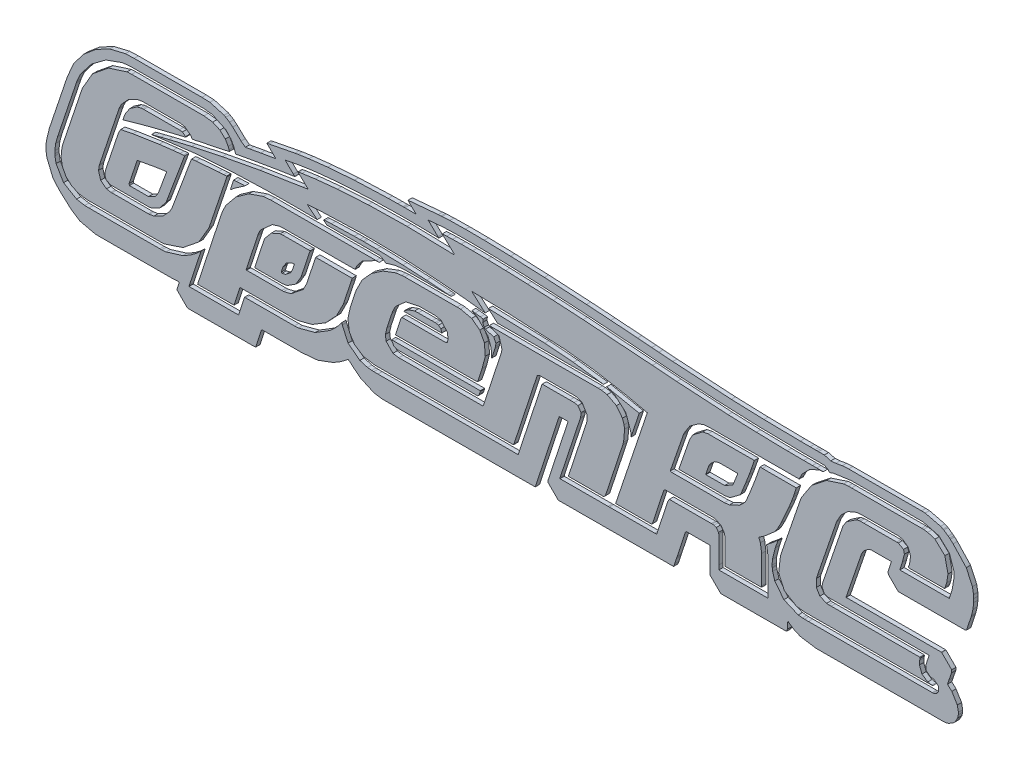
from build123d import *

# Parameters (mm, degrees)
BOSS_EXTRU_1_DEPTH    = 0.4
BOSS_EXTRU_1_2_DEPTH  = 0.4
BOSS_EXTRU_1_3_DEPTH  = 0.4
BOSS_EXTRU_1_4_DEPTH  = 0.4
BOSS_EXTRU_1_5_DEPTH  = 0.4
BOSS_EXTRU_1_6_DEPTH  = 0.4
BOSS_EXTRU_1_7_DEPTH  = 0.4
BOSS_EXTRU_1_8_DEPTH  = 0.4
BOSS_EXTRU_1_9_DEPTH  = 0.4
BOSS_EXTRU_1_10_DEPTH = 0.4
BOSS_EXTRU_1_11_DEPTH = 0.4
BOSS_EXTRU_1_12_DEPTH = 0.4
BOSS_EXTRU_1_13_DEPTH = 0.4
BOSS_EXTRU_1_14_DEPTH = 0.4
BOSS_EXTRU_1_15_DEPTH = 0.4
BOSS_EXTRU_1_16_DEPTH = 0.4
BOSS_EXTRU_1_17_DEPTH = 0.4


with BuildPart() as part:
    # Esquisse1 → Boss.-Extru.1 (new body)
    with BuildSketch(Plane.XY):
        Polygon((41.031215108, 10.587676012), (41.09815131, 11.16395312), (41.103061708, 11.488916264), (41.086468808, 11.774396873), (41.084350421, 11.802488739), (41.082807826, 11.819720388), (40.981651009, 12.399308119), (40.403476246, 13.653867984), (39.167737927, 14.970133199), (38.904284488, 15.204880924), (38.839631369, 15.261560175), (38.706337169, 15.37006367), (38.295692851, 15.647195355), (38.218579791, 15.689572147), (37.993453525, 15.803173377), (36.551980502, 16.156097871), (36.208718045, 16.166296553), (29.3755207, 16.150260667), (28.780270447, 16.114970361), (28.17662174, 16.009644537), (27.70561712, 15.973958416), (27.0973175, 16.142830444), (26.555064665, 16.143262767), (26.419501941, 16.142944634), (26.232421895, 16.142589385), (25.76365815, 16.14244763), (24.8476182, 16.145351533), (21.44234506, 16.196267525), (18.37899234, 16.301689963), (12.892457594, 16.631391996), (11.583902856, 16.730437868), (10.923617419, 16.782060961), (9.587761629, 16.885390249), (7.085132042, 17.06778692), (4.801086827, 17.219940643), (0.855829737, 17.443629287), (-2.31384919, 17.576676263), (-4.7737895, 17.639301654), (-6.542043384, 17.651885022), (-8.007942263, 17.62826436), (-8.723581381, 17.595310392), (-8.835391452, 17.587085669), (-9.092794744, 17.56438985), (-11.926656431, 17.314431765), (-11.739282789, 17.112394924), (-11.164248727, 16.566426486), (-11.281363276, 16.552493368), (-12.201931197, 16.556226735), (-12.314403446, 16.556061468), (-12.409643806, 16.555807615), (-12.875333008, 16.553154167), (-13.775654043, 16.541297274), (-16.955775974, 16.423217214), (-19.443543595, 16.235766471), (-21.214297217, 16.037176112), (-22.243377146, 15.885677209), (-22.529479006, 15.834920742), (-24.929463374, 15.370649707), (-25.164333041, 15.324929434), (-24.312653855, 14.48780417), (-25.726142312, 14.246562242), (-26.754672886, 14.064405145), (-27.177491119, 13.988801078), (-27.570882861, 14.286235062), (-28.362651446, 15.037108713), (-28.667090388, 15.28409617), (-29.008444991, 15.503861561), (-29.176399799, 15.593458388), (-30.499731017, 15.977969565), (-31.242631861, 16.008004308), (-37.597175259, 15.993091709), (-38.411998824, 15.966806036), (-39.880659512, 15.612541868), (-41.203689566, 14.919197708), (-42.337004709, 13.956918053), (-43.255744619, 12.758703541), (-43.866473628, 11.360696357), (-45.550431758, 6.329775335), (-45.83216704, 5.156871095), (-45.860946302, 4.630854859), (-45.856572118, 4.472363446), (-45.845678478, 4.313527362), (-45.833837898, 4.197759555), (-45.778327092, 3.845446049), (-45.228763523, 2.526650985), (-45.12986141, 2.389312071), (-45.099203279, 2.348555805), (-45.097771211, 2.346243974), (-44.933350293, 2.135854401), (-44.531423648, 1.707481896), (-43.509775767, 0.789182288), (-42.694161381, 0.251781386), (-41.236361869, -0.090477779), (-40.906207473, -0.097244019), (-34.231541885, -0.081580169), (-34.100567931, -0.081249833), (-33.803519413, -0.070758328), (-33.507675156, -0.04293795), (-33.371265878, -0.0860475), (-33.598385312, -0.777453621), (-33.330740628, -1.050294878), (-32.613577391, -1.764099973), (-32.367745857, -1.781776447), (-26.429671645, -1.767841202), (-26.19202718, -1.735983615), (-25.679259839, -0.147137073), (-25.620784755, -0.047161707), (-21.889677345, -0.038405687), (-20.384313266, 0.096387901), (-18.974853906, 0.617258792), (-18.335542918, 0.986859199), (-17.886929754, 1.305734166), (-17.554352811, 1.581719532), (-17.358268699, 1.457685552), (-17.045512508, 1.175193832), (-16.401655795, 0.665853385), (-15.117351667, 0.081090492), (-14.372723659, -0.026097409), (-14.005694536, -0.034114925), (-0.314105937, -0.001984029), (0, 0), (2.242401289, 6.836376694), (2.309294828, 6.849548885), (3.071570712, 6.851337765), (3.071657885, 6.826556977), (1.20175268, 1.142599241), (1.185082425, 0.974970649), (2.117627182, 0.046792565), (2.245113196, 0.004021848), (8.39370797, 0.018451135), (8.462354841, 0.018801941), (12.970348753, 0.029570382), (13.0717447, 0.299123675), (13.238554197, 0.807555195), (13.290319469, 0.964604171), (13.291421089, 0.967334205), (13.31245655, 1.031461615), (14.068447224, 3.337475041), (14.132207296, 3.454132532), (16.216907098, 3.459024826), (16.380444521, 3.453299359), (16.38610873, 1.039671832), (16.715085577, 0.712125204), (17.386761645, 0.043594283), (17.454715504, 0.03971516), (23.553571651, 0.054027723), (23.641420701, 0.275342794), (23.640214405, 0.789368857), (23.702260772, 0.934608468), (23.984157954, 0.724301263), (24.285015867, 0.540935363), (24.844310348, 0.290580143), (26.299700967, 0.060472234), (38.262966822, 0.088547168), (38.323396361, 0.08983391), (38.441703776, 0.099919404), (38.753482812, 0.176814205), (39.243060768, 0.486196171), (39.368611545, 0.625274258), (39.588586514, 1.022573618), (39.662394995, 1.34659464), (39.669374771, 1.549077722), (39.56209015, 2.081195227), (39.049114739, 2.93412127), (38.641510464, 3.305010997), (38.77814893, 3.715863645), (39.025915661, 4.428955445), (39.036531199, 4.679887434), (38.107899317, 5.604170965), (38.083015864, 5.623240871), (29.139635521, 5.602252889), (29.155851441, 5.676308582), (30.504231556, 9.615922065), (30.591247326, 9.87016321), (30.592903761, 9.875560638), (30.77409942, 10.192606053), (31.220190543, 10.553055022), (31.4263113, 10.623839203), (31.508867812, 10.633238047), (31.562968153, 10.634110185), (33.270056664, 10.638116315), (33.387186548, 10.633412862), (33.056155399, 9.62405002), (33.126070602, 9.417673332), (34.02482235, 8.52313002), (34.114832737, 8.521133916), (40.342302449, 8.535748304), (40.431288869, 8.601219144), (40.846935918, 9.856568471), (40.864008495, 9.908007326), (40.895627269, 10.012369509), align=None)
        Polygon((38.809010347, 10.359893063), (38.659492336, 10.358963453), (34.175911526, 10.348441557), (34.411391067, 11.107161129), (34.413331925, 11.113637049), (34.603493683, 11.83989621), (34.526426288, 12.193519835), (34.021053291, 12.464690188), (33.872016, 12.466693274), (30.79558034, 12.459473613), (30.488976156, 12.45817296), (30.363270125, 12.4487181), (30.109968572, 12.395007225), (29.151536546, 11.739595239), (28.847995716, 11.252203416), (28.802610661, 11.126787047), (26.949963226, 5.714270998), (26.922774373, 5.619082536), (26.892861205, 5.443560883), (26.891194061, 5.304834969), (27.096794381, 4.889898109), (27.391642218, 4.782071938), (27.502608139, 4.773826098), (27.590089088, 4.77342716), (36.677015294, 4.79475201), (36.927502276, 4.79386709), (36.738037015, 4.248512691), (36.601281544, 3.7898644), (36.64446716, 3.415666308), (37.048506525, 3.095536519), (37.377873842, 3.065209225), (37.795497634, 2.719505604), (37.815528815, 2.325771148), (37.707080726, 2.124395803), (37.507600148, 1.969314552), (37.333155801, 1.918205945), (37.27086432, 1.913487955), (37.21163352, 1.913244243), (25.619604927, 1.886040514), (25.238517365, 1.885293053), (25.038392455, 1.891372093), (24.649347848, 1.933390487), (23.307927701, 2.503441492), (22.453455014, 3.587796669), (22.25240901, 4.270795412), (22.219654564, 4.520336579), (22.212980817, 4.600127832), (22.206039669, 4.760111858), (22.228795525, 5.220030328), (22.503303342, 6.309846263), (22.736681505, 6.991768175), (22.719960405, 7.03988648), (22.46361137, 6.790786509), (21.916007138, 6.343691154), (21.67620646, 6.14237232), (21.732371861, 5.91609478), (21.795429745, 5.447159348), (21.802649112, 5.221428767), (21.81018944, 2.008351288), (21.810287385, 1.877100953), (17.211428338, 1.866308527), (17.208590013, 2.274356568), (17.202675823, 4.794505527), (17.184120166, 4.900913339), (16.966387762, 5.192736761), (16.7522737, 5.270957869), (16.597193333, 5.286229953), (16.505759307, 5.287056478), (12.567735933, 5.277814875), (12.426277835, 5.040274874), (11.534671814, 2.321231207), (11.511886654, 2.251825157), (11.503601198, 2.227478285), (11.386017033, 1.86900839), (11.190218788, 1.852557145), (6.948644978, 1.842603182), (6.946174628, 1.842584776), (6.831075336, 1.841948312), (2.324405236, 1.831372231), (2.330807278, 1.933770758), (4.218389572, 7.672292491), (4.246728934, 7.760493835), (4.300117606, 8.100140916), (4.295397422, 8.182489171), (4.001305454, 8.609249636), (3.653856264, 8.679830031), (3.241526751, 8.678952024), (0.652734918, 8.673203512), (0.593904627, 8.520076342), (-1.458317622, 2.263085807), (-1.472203959, 2.220822398), (-1.600876496, 1.829073579), (-1.682300939, 1.821969447), (-14.748062406, 1.791307218), (-15.129323983, 1.790685704), (-15.329203761, 1.79738584), (-15.717737576, 1.84068722), (-16.441406165, 2.052904086), (-17.549292692, 2.902077831), (-18.08699114, 4.111213601), (-18.131625988, 4.283464928), (-18.163587738, 4.236583101), (-18.228530384, 4.143368949), (-18.345018347, 3.992626927), (-18.618104701, 3.673363503), (-19.221774388, 3.097415056), (-20.625372002, 2.222766096), (-22.214495912, 1.800862659), (-22.574257903, 1.787152069), (-27.131968704, 1.776456208), (-27.254197878, 1.772383929), (-27.730746555, 0.295095821), (-27.809808779, 0.055894768), (-32.45914126, 0.044983893), (-32.414977182, 0.180096606), (-31.328614182, 3.48775175), (-31.478905596, 3.341719343), (-31.824963434, 3.034466725), (-32.325571604, 2.665863708), (-33.041339052, 2.25725967), (-34.608864052, 1.77555059), (-35.013036774, 1.745149684), (-35.185721027, 1.743344903), (-41.837124525, 1.727735644), (-42.234583057, 1.735440389), (-42.993036505, 1.8672793), (-44.216797977, 2.592327488), (-44.916313254, 3.790549479), (-45.022355965, 4.369917339), (-45.033181342, 4.529128608), (-45.033829859, 4.780832058), (-44.959104015, 5.395231045), (-44.782538821, 6.024565778), (-43.019775852, 11.290864363), (-42.966353292, 11.447452246), (-42.620360748, 12.208674639), (-41.591021554, 13.53814897), (-40.254405586, 14.532583641), (-38.701141528, 15.09344044), (-37.906305419, 15.167176941), (-31.058819916, 15.183246358), (-30.292338913, 15.110288434), (-28.98839644, 14.490968193), (-28.517727795, 13.973849787), (-28.269566235, 13.528702247), (-28.109411621, 13.063496458), (-28.093506346, 12.998975412), (-28.089682974, 12.982963337), (-27.250106363, 13.13751775), (-26.207437555, 13.323066942), (-24.705850341, 13.584735267), (-22.9289166, 13.867495946), (-22.53571917, 13.926489374), (-22.574717316, 13.964221307), (-22.652546904, 14.039726957), (-22.654249674, 14.041681424), (-22.683151096, 14.069737398), (-23.405662334, 14.769622292), (-23.423901464, 14.821359858), (-22.435927293, 15.012396644), (-22.278786402, 15.042083279), (-21.900597632, 15.105133892), (-21.215235024, 15.204524383), (-20.229104284, 15.325267492), (-18.948611113, 15.452375957), (-17.380161217, 15.570862518), (-15.530160297, 15.665739914), (-13.405014059, 15.722020884), (-12.321007015, 15.730858534), (-12.130428505, 15.731077401), (-11.351329312, 15.727927653), (-9.713274585, 15.700818595), (-9.287283998, 15.689372044), (-9.03468811, 15.682333855), (-9.052133689, 15.698885528), (-9.119340778, 15.762727492), (-9.120469801, 15.763819383), (-9.917171629, 16.519937507), (-10.055200276, 16.650995898), (-8.982227798, 16.74573479), (-8.646615489, 16.773370649), (-8.263696345, 16.793083538), (-7.590369079, 16.813938663), (-6.595281444, 16.826300633), (-5.625446971, 16.824271182), (-4.324374605, 16.805850757), (-2.756123418, 16.765429167), (-0.903796355, 16.697782807), (1.249503633, 16.597688067), (3.720673598, 16.459921343), (6.526610593, 16.279259026), (9.684211668, 16.05047751), (10.530539573, 15.985151365), (11.123917103, 15.938576849), (11.956707433, 15.874151219), (13.633402837, 15.750781663), (17.116641598, 15.536236669), (20.935656644, 15.384173928), (25.285622791, 15.318061552), (26.42106415, 15.317569506), (26.477581221, 15.317702138), (27.112260594, 15.3137784), (27.471612499, 15.121700672), (27.600294014, 14.957098893), (27.684164701, 14.993091966), (27.726392169, 15.01038399), (27.94804548, 15.089172096), (29.602605201, 15.325604268), (36.202905308, 15.341093599), (36.372842086, 15.33875049), (37.82525155, 14.964820028), (38.839060905, 14.010020577), (39.25723763, 12.735872513), (39.258230799, 12.723293066), (39.274312763, 12.381899696), (39.073353476, 11.158407192), align=None, mode=Mode.SUBTRACT)
    extrude(amount=BOSS_EXTRU_1_DEPTH)


with BuildPart() as body_2:
    # Esquisse1 → Boss.-Extru.1 2 (new body)
    with BuildSketch(Plane.XY):
        Polygon((36.790510233, 14.712499425), (36.407625642, 14.754228588), (36.21875651, 14.758477036), (29.653221306, 14.743069289), (29.343005434, 14.742195156), (28.931135205, 14.715406682), (27.306306362, 14.178573004), (25.914279124, 13.090254245), (24.944678842, 11.616547988), (24.803850566, 11.23228309), (22.994075911, 5.945240735), (22.81610255, 4.434821911), (23.352750212, 3.249862348), (24.490085023, 2.561424134), (25.250221505, 2.467325319), (25.383448339, 2.467571631), (37.258013643, 2.495438406), (37.158329521, 2.497814532), (36.786832405, 2.562742824), (36.250001973, 2.938187899), (36.017845929, 3.559253305), (36.035960137, 3.935506345), (36.085378965, 4.137691832), (36.063048766, 4.210846895), (27.740532337, 4.191315932), (27.506114414, 4.191160346), (27.307246524, 4.205913224), (26.678575331, 4.478587436), (26.348096957, 5.022503591), (26.359214626, 5.762583136), (26.449556585, 6.048850745), (28.247537335, 11.301438605), (28.66076813, 12.058899397), (29.320410753, 12.66014431), (30.119543597, 12.997573957), (30.528292068, 13.040552709), (33.818578521, 13.048274227), (34.066107269, 13.044927627), (34.425440452, 12.975036992), (34.959384042, 12.591692172), (35.183423758, 11.957395335), (35.082100759, 11.283909786), (34.980939082, 10.975093821), (35.038343504, 10.932361319), (38.366286714, 10.940171208), (38.460665329, 11.159425927), (38.565861594, 11.495933842), (38.690543692, 12.278276223), (38.395934705, 13.614548315), (37.46554482, 14.495750731), align=None)
    extrude(amount=BOSS_EXTRU_1_2_DEPTH)


with BuildPart() as body_3:
    # Esquisse1 → Boss.-Extru.1 3 (new body)
    with BuildSketch(Plane.XY):
        Polygon((21.296471416, 12.15296012), (21.062134658, 12.152254942), (20.982532953, 11.919332736), (20.766647672, 11.287068011), (20.660568198, 10.994772911), (20.468864204, 10.490326865), (19.995374328, 9.299662915), (19.79698428, 8.8407855), (19.678551221, 8.621119536), (19.510404859, 8.420323392), (19.126976072, 8.075272636), (18.206120532, 7.643424049), (17.731627398, 7.590610367), (12.819891871, 7.579083694), (12.648556964, 7.610683012), (13.885571157, 11.168439788), (13.941570743, 11.326909495), (14.491020409, 12.189815533), (15.318524521, 12.785647373), (15.792533682, 12.947565431), (16.409856748, 12.993398519), (24.640124518, 13.012712996), (24.748628009, 13.013372145), (24.753914144, 13.01868315), (24.787922625, 13.10302188), (25.012255838, 13.551959901), (25.730793539, 14.293955514), (26.651374182, 14.698484136), (27.002256855, 14.736848107), (26.39361629, 14.735420779), (25.981101081, 14.734921945), (25.172382705, 14.736380882), (23.61684384, 14.74872288), (20.726555576, 14.807820664), (18.079601668, 14.906550709), (13.270649261, 15.192894207), (10.986126932, 15.365500973), (4.492891252, 15.829164602), (1.687093195, 15.991747689), (-0.728826131, 16.107447851), (-2.777348098, 16.183258075), (-4.480954078, 16.226171346), (-5.862125442, 16.243180652), (-6.943343561, 16.241278977), (-7.747089808, 16.227459307), (-8.295845554, 16.208714629), (-8.718311029, 16.184422193), (-8.631747688, 16.102110359), (-7.598821072, 15.122412736), (-7.622831322, 15.045160704), (-12.016659181, 15.148441465), (-15.667896595, 15.077295143), (-18.546394973, 14.902123323), (-20.622005724, 14.69332759), (-21.864580257, 14.52130953), (-22.164057506, 14.471092623), (-22.245744956, 14.455663268), (-21.277973107, 13.518499356), (-21.77580246, 13.448313797), (-25.808007937, 12.809203306), (-29.317704771, 12.151524414), (-32.19707129, 11.539288013), (-34.33828582, 11.036504992), (-35.098391816, 10.846161902), (-35.633526687, 10.707186242), (-35.930212725, 10.627579371), (-35.984925647, 10.612539658), (-35.863218855, 10.63306135), (-35.443669932, 10.702169938), (-31.942751185, 11.132359585), (-28.4135507, 11.378499629), (-25.178876638, 11.488655712), (-22.561537162, 11.510893478), (-21.585245444, 11.504063506), (-20.884340434, 11.493278571), (-20.499173151, 11.484546878), (-20.439771913, 11.485579361), (-21.377505482, 12.249115074), (-21.357531685, 12.254849801), (-20.300259091, 12.329266815), (-16.156299547, 12.460982312), (-12.323075262, 12.390583957), (-9.033287479, 12.202618744), (-7.664901414, 12.090969502), (-6.519637441, 11.981633669), (-5.626583214, 11.885179619), (-5.01482639, 11.812175726), (-4.713454623, 11.773190365), (-4.695864083, 11.778001478), (-5.962425947, 12.9084289), (-5.693834591, 12.901443238), (-5.020342534, 12.885238142), (-2.390031625, 12.827739262), (2.835465901, 12.562195705), (5.597071484, 12.239880872), (8.568860925, 11.715023898), (10.159577557, 11.358787397), (10.502666494, 11.275035342), (7.537215059, 2.428204218), (7.590135342, 2.425814965), (10.887646698, 2.433553439), (10.980573358, 2.499082554), (12.062990793, 5.799313449), (12.184258544, 5.859000265), (16.489691945, 5.869104092), (16.820675764, 5.849673801), (17.370910109, 5.619682005), (17.707509126, 5.171751721), (17.779273089, 4.888225014), (17.785047266, 4.753324796), (17.790417405, 2.465005702), (17.929428203, 2.450078822), (21.211727515, 2.457781596), (21.226753548, 2.583855552), (21.220576744, 5.215909705), (21.103949029, 6.025234629), (20.951257747, 6.399557446), (21.460372999, 6.735039563), (22.457955464, 7.605868479), (22.722241953, 7.988676058), (23.051452222, 8.614789221), (23.739358061, 10.146458738), (24.014636398, 10.8246099), (24.188520189, 11.292701869), (24.263420444, 11.522705274), (24.470740867, 12.160409374), align=None)
    extrude(amount=BOSS_EXTRU_1_3_DEPTH)


with BuildPart() as body_4:
    # Esquisse1 → Boss.-Extru.1 4 (new body)
    with BuildSketch(Plane.XY):
        Polygon((14.752069672, 11.59796037), (14.475098275, 11.092343789), (13.45669195, 8.162852913), (17.762811133, 8.172958349), (18.275315508, 8.271364775), (19.21236368, 8.970285068), (19.252155836, 9.050528871), (19.37919515, 9.336374716), (19.719812869, 10.173163788), (20.049052911, 11.023805636), (20.219609993, 11.487818281), (20.538589711, 12.421191832), (16.199500588, 12.411198505), (15.698172412, 12.314144673), align=None)
        Polygon((18.588375884, 9.586173169), (18.512699379, 9.416954928), (17.760874621, 8.998143117), (15.991335856, 8.993990431), (15.983602708, 9.029494771), (16.246646704, 9.785772258), (16.284931063, 9.884979116), (16.415810788, 10.102502424), (16.832615446, 10.468373406), (17.208221639, 10.586211948), (18.971203087, 10.590349246), (18.930234559, 10.43554528), (18.761683247, 10.009880208), align=None, mode=Mode.SUBTRACT)
    extrude(amount=BOSS_EXTRU_1_4_DEPTH)


with BuildPart() as body_5:
    # Esquisse1 → Boss.-Extru.1 5 (new body)
    with BuildSketch(Plane.XY):
        Polygon((8.967034641, 8.527109975), (9.748478668, 10.858043041), (6.690888473, 11.477101975), (7.425916689, 11.22132237), (8.485201875, 10.296109781), (8.95334122, 8.952462456), (8.953724182, 8.950758027), (8.970801169, 8.617690683), align=None)
    extrude(amount=BOSS_EXTRU_1_5_DEPTH)


with BuildPart() as body_6:
    # Esquisse1 → Boss.-Extru.1 6 (new body)
    with BuildSketch(Plane.XY):
        Polygon((6.401630159, 11.524172341), (3.567953866, 11.904463097), (0.884325953, 12.119387171), (-4.394513799, 12.289540153), (-3.544617976, 11.531337291), (5.91667962, 11.553540702), align=None)
    extrude(amount=BOSS_EXTRU_1_6_DEPTH)


with BuildPart() as body_7:
    # Esquisse1 → Boss.-Extru.1 7 (new body)
    with BuildSketch(Plane.XY):
        Polygon((-5.955889206, 11.33109954), (-5.473383941, 11.105207426), (-4.436183909, 10.041896228), (-4.171689804, 9.333283992), (-4.106562423, 8.94943855), (-4.096769499, 8.844052087), (-4.087506084, 8.527358447), (-4.091152867, 8.416293855), (-4.081653713, 8.417701657), (-3.763708202, 9.385164297), (-3.712622923, 9.580361567), (-3.695499335, 9.808554472), (-3.88936538, 10.237286702), (-4.671720996, 10.461965122), (-4.783546728, 10.55880749), (-4.929846906, 10.893192991), (-4.875434267, 11.191438393), (-5.138744778, 11.241269784), (-5.644948496, 11.301683971), align=None)
    extrude(amount=BOSS_EXTRU_1_7_DEPTH)


with BuildPart() as body_8:
    # Esquisse1 → Boss.-Extru.1 8 (new body)
    with BuildSketch(Plane.XY):
        Polygon((8.323112655, 9.21025694), (8.170628653, 9.668966021), (7.611124738, 10.407003776), (6.737770731, 10.867053897), (6.199848278, 10.960719508), (5.915986274, 10.971264274), (-4.294812571, 10.947301963), (-4.306723298, 10.946754604), (-3.385675498, 10.559673282), (-3.119881178, 9.615874095), (-3.172014421, 9.332064038), (-3.224216951, 9.162312141), (-4.84752891, 4.22169412), (-4.891618016, 4.114736051), (-12.786720409, 4.096208127), (-13.335460386, 4.18238745), (-13.981440967, 4.840717066), (-14.044715037, 5.354148931), (-13.906565619, 5.956371826), (-13.438782182, 7.370934678), (-13.38323692, 7.539371865), (-13.099880297, 8.10268113), (-12.138468071, 8.95711824), (-10.862672293, 9.22769756), (-9.478195737, 9.230946597), (-9.34815899, 9.230082992), (-8.82532055, 9.11588276), (-8.220375764, 8.4172002), (-8.184948806, 7.890945545), (-8.240760517, 7.605599812), (-8.386671591, 7.529316943), (-12.501242365, 7.519661026), (-12.575516961, 7.406725117), (-13.106963232, 5.799647795), (-5.467066529, 5.817576812), (-5.404616603, 5.832580691), (-4.972684701, 7.138729596), (-4.685843384, 8.266352219), (-4.765786679, 9.308041071), (-5.201563287, 10.135343985), (-5.962947062, 10.704886957), (-7.007765093, 10.938547496), (-7.334490464, 10.940168563), (-12.243856449, 10.928647451), (-12.511631012, 10.919994217), (-13.112630011, 10.830897605), (-14.296498868, 10.379180683), (-15.361008813, 9.648715817), (-16.232062189, 8.68336685), (-16.798949373, 7.553826141), (-16.861546282, 7.362902266), (-17.329329718, 5.948339415), (-17.561989049, 4.893247216), (-17.426090396, 3.87400206), (-16.931142971, 3.07939192), (-16.120983214, 2.54995191), (-15.045138524, 2.372695371), (-2.039719761, 2.40321599), (-1.978037537, 2.546332201), (0.190346907, 9.156870648), (0.406135049, 9.254142766), (3.642395691, 9.261737498), (3.914730169, 9.240449242), (4.386111757, 9.058286852), (4.872537849, 8.262960225), (4.836128891, 7.711409605), (4.79600551, 7.56570496), (4.74902147, 7.42263407), (3.118911805, 2.46620431), (3.124020214, 2.415334057), (6.410863764, 2.423047496), (6.573561884, 2.571504465), (8.202434923, 7.515538334), (8.279315847, 7.780084985), (8.374619236, 8.891885337), align=None)
    extrude(amount=BOSS_EXTRU_1_8_DEPTH)


with BuildPart() as body_9:
    # Esquisse1 → Boss.-Extru.1 9 (new body)
    with BuildSketch(Plane.XY):
        Polygon((-8.75945954, 8.120236511), (-8.760707985, 8.136756861), (-8.847597607, 8.413300536), (-9.080332596, 8.59208545), (-9.274505599, 8.641228341), (-9.396676995, 8.649123649), (-9.679962007, 8.64857726), (-10.971202594, 8.645547026), (-11.311147064, 8.631732808), (-11.899510532, 8.424802292), (-12.269555914, 8.165196977), (-12.32137755, 8.118347355), (-12.315479828, 8.102371767), (-8.877968812, 8.110438787), (-8.758929462, 8.111676818), align=None)
    extrude(amount=BOSS_EXTRU_1_9_DEPTH)


with BuildPart() as body_10:
    # Esquisse1 → Boss.-Extru.1 10 (new body)
    with BuildSketch(Plane.XY):
        Polygon((-13.244028324, 4.785686227), (-12.98223159, 4.68988184), (-12.726620678, 4.678438743), (-5.38888177, 4.696029118), (-5.248417764, 4.86722889), (-5.143456379, 5.186794007), (-5.150988956, 5.236612212), (-13.257270058, 5.217588702), (-13.463304417, 5.216626249), (-13.463110487, 5.213308254), (-13.461749094, 5.186791895), align=None)
    extrude(amount=BOSS_EXTRU_1_10_DEPTH)


with BuildPart() as body_11:
    # Esquisse1 → Boss.-Extru.1 11 (new body)
    with BuildSketch(Plane.XY):
        Polygon((-14.18889506, 11.328056924), (-14.116671068, 11.235670179), (-14.002574861, 11.154445236), (-13.909872631, 11.193565999), (-13.089316561, 11.430824658), (-12.218339225, 11.510982134), (-7.940252097, 11.521021786), (-7.87306505, 11.525016446), (-8.000992214, 11.536227196), (-8.033452631, 11.53902876), (-8.049804625, 11.540429256), (-8.252306854, 11.557515375), (-10.18277007, 11.698323143), (-12.408778378, 11.811806991), (-14.864161487, 11.874397702), (-16.0265355, 11.879679248), (-16.159680889, 11.879229395), (-16.426974408, 11.877652866), (-16.965306837, 11.871793136), (-19.109762536, 11.808589974), (-19.657676037, 11.782359657), (-19.837314496, 11.745762318), (-19.581166965, 11.53719512), (-19.513795227, 11.493861438), (-14.607955972, 11.505374065), (-14.601887186, 11.505346881), (-14.589776012, 11.505090527), (-14.565614996, 11.503768309), align=None)
    extrude(amount=BOSS_EXTRU_1_11_DEPTH)


with BuildPart() as body_12:
    # Esquisse1 → Boss.-Extru.1 12 (new body)
    with BuildSketch(Plane.XY):
        Polygon((-17.254901197, 8.067151105), (-17.167640456, 8.360616221), (-20.580491367, 8.352607073), (-21.424250193, 5.801484332), (-21.745231561, 5.161605842), (-22.892357923, 4.239892317), (-23.576538518, 4.074109582), (-23.757278116, 4.070462843), (-27.065093411, 4.062700188), (-27.098654321, 4.092211585), (-26.014878134, 7.396396567), (-25.979566102, 7.504372363), (-25.917104028, 7.67118255), (-25.747770977, 7.992765487), (-24.64858834, 8.97011376), (-23.960685414, 9.181257375), (-23.785503138, 9.195999104), (-23.70403535, 9.197561941), (-16.88332119, 9.213568532), (-16.854712828, 9.288954881), (-16.704319282, 9.613055363), (-16.244242682, 10.199893601), (-14.968762479, 10.88947255), (-14.618708499, 10.923042317), (-14.925481849, 10.922354315), (-24.795771707, 10.899191097), (-25.484562004, 10.84553487), (-26.847752578, 10.370202598), (-28.051608874, 9.519430418), (-28.995661341, 8.366314555), (-29.319433694, 7.712541434), (-29.439239025, 7.373800395), (-31.611695685, 0.75970319), (-31.639318319, 0.629182623), (-28.353723297, 0.636893132), (-28.231807635, 0.637492283), (-27.678065597, 2.354282589), (-27.540032275, 2.357394419), (-22.594542522, 2.369000305), (-22.283048822, 2.379286307), (-20.905854024, 2.734905414), (-19.649224916, 3.49943407), (-18.62677444, 4.584074139), (-17.994598856, 5.830909692), align=None)
    extrude(amount=BOSS_EXTRU_1_12_DEPTH)


with BuildPart() as body_13:
    # Esquisse1 → Boss.-Extru.1 13 (new body)
    with BuildSketch(Plane.XY):
        Polygon((-23.702816314, 8.615668963), (-23.902179626, 8.601861575), (-24.743769944, 8.233316891), (-25.357711648, 7.496591049), (-25.434471946, 7.299214726), (-26.247110419, 4.8212959), (-26.287637471, 4.646799493), (-23.827960408, 4.652571769), (-23.657369145, 4.653316095), (-23.251446023, 4.726532903), (-22.441333639, 5.243098211), (-21.94307591, 6.086965295), (-21.142573514, 8.50694036), (-21.109097739, 8.608314501), (-21.10484016, 8.621216459), (-21.27562155, 8.62136501), align=None)
        Polygon((-23.734194986, 5.478170608), (-23.813706646, 5.530722616), (-23.643446293, 6.049857963), (-23.348451708, 6.485724215), (-22.866896657, 6.767417788), (-22.584401495, 6.791129312), (-22.614028095, 6.685769307), (-22.7180394, 6.371386959), (-22.763877797, 6.232307916), (-22.923154293, 5.939320483), (-23.399379093, 5.554260195), align=None, mode=Mode.SUBTRACT)
    extrude(amount=BOSS_EXTRU_1_13_DEPTH)


with BuildPart() as body_14:
    # Esquisse1 → Boss.-Extru.1 14 (new body)
    with BuildSketch(Plane.XY):
        Polygon((-27.999417737, 10.80140894), (-28.272592882, 10.779621498), (-28.303810583, 10.686887638), (-28.338150538, 10.584487365), (-28.562410891, 9.918723251), (-28.52789657, 9.870102846), (-28.292393037, 10.085809967), (-27.208014237, 10.836306907), align=None)
    extrude(amount=BOSS_EXTRU_1_14_DEPTH)


with BuildPart() as body_15:
    # Esquisse1 → Boss.-Extru.1 15 (new body)
    with BuildSketch(Plane.XY):
        Polygon((-28.908648357, 10.71392848), (-28.940785315, 10.767392865), (-29.196969618, 10.752830821), (-29.712518951, 10.721285473), (-31.798912283, 10.560239551), (-32.222264155, 10.507129742), (-33.995223044, 5.764300061), (-34.03332198, 5.663816318), (-34.250636402, 5.245837725), (-34.905585422, 4.540361414), (-35.745818589, 4.116830116), (-36.186039373, 4.043357587), (-36.283231692, 4.041067414), (-39.686264154, 4.033081308), (-39.785398883, 4.034910748), (-40.186123557, 4.106409778), (-40.744975591, 4.526657757), (-40.933555358, 5.230154507), (-40.871185127, 5.647769483), (-40.840373319, 5.750114106), (-39.034937039, 11.143920545), (-39.000074729, 11.246274673), (-38.792672843, 11.664230004), (-38.138519364, 12.376904722), (-37.297429926, 12.807099468), (-36.847432949, 12.880739271), (-36.746854001, 12.883051847), (-33.339110836, 12.89067222), (-33.24331594, 12.888818313), (-32.852413718, 12.8171519), (-32.287285814, 12.390257212), (-32.202767479, 12.240266038), (-32.169428388, 12.160093843), (-31.875255974, 12.207616486), (-31.375646721, 12.31682926), (-29.148945311, 12.778814787), (-28.668455403, 12.899657013), (-28.702431727, 13.023110695), (-28.787386837, 13.259377103), (-29.052960554, 13.720151695), (-29.560498808, 14.193077359), (-30.236390867, 14.49869673), (-31.056299577, 14.60059851), (-37.82925838, 14.584703989), (-38.262401515, 14.567072399), (-40.017841602, 13.998193139), (-41.497638083, 12.788757389), (-42.452397344, 11.151450596), (-44.247858838, 5.787444193), (-44.367480473, 5.375782675), (-44.451143176, 4.548909305), (-44.312666001, 3.810905673), (-43.977800172, 3.198258958), (-43.465428427, 2.726410466), (-42.789080752, 2.413910899), (-41.969124546, 2.309511192), (-35.200755865, 2.32539494), (-34.768108366, 2.343404329), (-33.022848597, 2.922444296), (-31.533031408, 4.12160646), (-30.577669036, 5.758648211), align=None)
    extrude(amount=BOSS_EXTRU_1_15_DEPTH)


with BuildPart() as body_16:
    # Esquisse1 → Boss.-Extru.1 16 (new body)
    with BuildSketch(Plane.XY):
        Polygon((-38.863169111, 9.5864139), (-39.072760844, 9.197528587), (-40.291312996, 5.556982635), (-40.350502312, 5.152817535), (-40.224974448, 4.803395144), (-39.759640825, 4.616762302), (-39.638045938, 4.615652169), (-36.388840791, 4.622917504), (-36.230047915, 4.624155397), (-36.031257703, 4.647097578), (-35.19662127, 5.051790889), (-34.59982855, 5.819678291), (-34.555006135, 5.928877252), (-34.435054659, 6.250221658), (-32.865980647, 10.448015061), (-32.986075628, 10.448896011), (-33.310785862, 10.41667244), (-33.958952971, 10.348228689), (-35.243489909, 10.194666186), (-37.711103909, 9.815332653), align=None)
        Polygon((-38.040867249, 5.444390493), (-38.066944746, 5.602634526), (-37.311726983, 7.858588694), (-35.790844586, 8.135370886), (-34.993198516, 8.25785591), (-34.587210366, 8.31531607), (-34.575219993, 8.232260873), (-35.316348823, 6.249544381), (-35.351648104, 6.160646407), (-35.613553509, 5.785271127), (-36.234465222, 5.450564465), (-36.284175761, 5.448151438), align=None, mode=Mode.SUBTRACT)
    extrude(amount=BOSS_EXTRU_1_16_DEPTH)


with BuildPart() as body_17:
    # Esquisse1 → Boss.-Extru.1 17 (new body)
    with BuildSketch(Plane.XY):
        Polygon((-32.866832206, 11.982570049), (-32.747892814, 12.029013196), (-32.768557743, 12.063220636), (-33.080738817, 12.278875207), (-33.366405242, 12.308526016), (-36.695924058, 12.301080557), (-36.803416142, 12.300031913), (-36.979029376, 12.282649251), (-37.338734161, 12.177249078), (-38.012907222, 11.711576793), (-38.45547305, 11.040363503), (-38.576955189, 10.678838539), (-38.640857769, 10.487953279), (-38.453181553, 10.532823014), (-38.025246795, 10.658626167), (-36.298220928, 11.133663465), (-34.167517139, 11.670116561), align=None)
    extrude(amount=BOSS_EXTRU_1_17_DEPTH)


solid = Compound([part.part, body_2.part, body_3.part, body_4.part, body_5.part, body_6.part, body_7.part, body_8.part, body_9.part, body_10.part, body_11.part, body_12.part, body_13.part, body_14.part, body_15.part, body_16.part, body_17.part])
